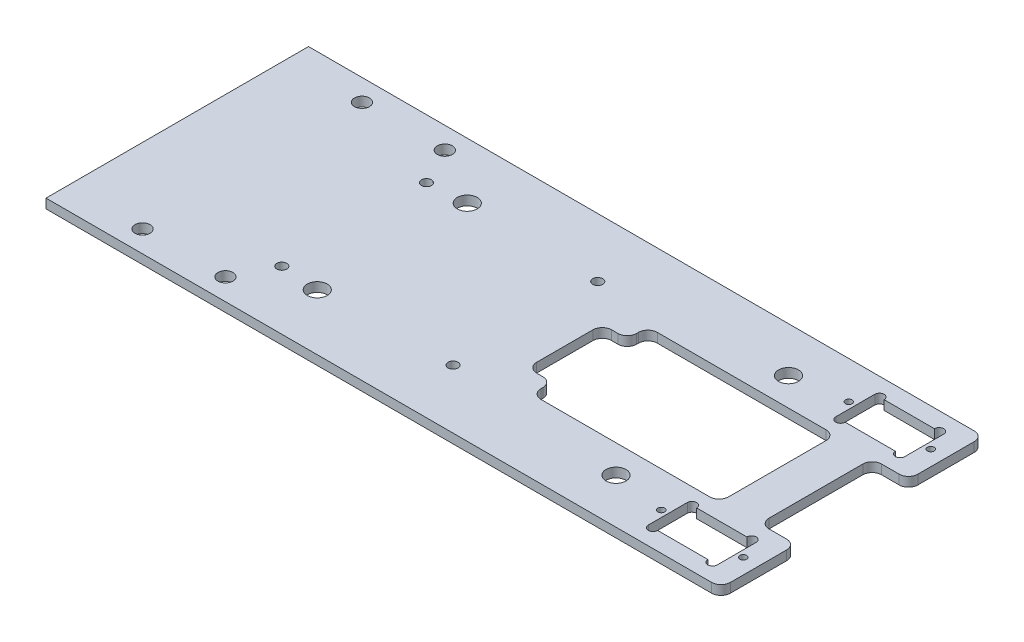
from build123d import *

# Parameters (mm, degrees)
SKETCH1_W           = 304.8
SKETCH1_H           = 101.6
BOSS_EXTRUDE1_DEPTH = 3.175
SKETCH2_R           = 1.6891
CUT_EXTRUDE1_DEPTH  = 161.675077797
SKETCH4_W           = 329.101017338
SKETCH4_H           = 140.380533162
SKETCH4_W_2         = 228.6
SKETCH4_H_2         = 88.9
CUT_EXTRUDE3_DEPTH  = 161.675077797
SKETCH6_R           = 2.5527
SKETCH6_R_2         = 3.3782
CUT_EXTRUDE4_DEPTH  = 123.679962198
CUT_EXTRUDE5_DEPTH  = 123.679962198
SKETCH8_W           = 24.61012588
SKETCH8_H           = 38.1
CUT_EXTRUDE6_DEPTH  = 123.679962198
FILLET1_R           = 3.175
SKETCH9_R           = 1.143
CUT_EXTRUDE7_DEPTH  = 123.679962198


with BuildPart() as part:
    # Sketch1 → Boss-Extrude1 (new body)
    with BuildSketch(Plane(origin=(0, 0, 0), x_dir=(1, 0, 0), z_dir=(0, 1, 0))):
        Rectangle(SKETCH1_W, SKETCH1_H)
    extrude(amount=BOSS_EXTRUDE1_DEPTH)

    # Sketch2 → Cut-Extrude1 (cut, through all)
    with BuildSketch(Plane(origin=(0, 3.175, 0), x_dir=(1, 0, 0), z_dir=(0, 1, 0))):
        with Locations((-54.4, -24.5)):
            Circle(SKETCH2_R)
        with Locations((3.6, -24.5)):
            Circle(SKETCH2_R)
        with Locations((3.6, 24.5)):
            Circle(SKETCH2_R)
        with Locations((-54.4, 24.5)):
            Circle(SKETCH2_R)
    extrude(amount=-CUT_EXTRUDE1_DEPTH, mode=Mode.SUBTRACT)

    # Sketch4 → Cut-Extrude3 (cut, through all)
    with BuildSketch(Plane(origin=(0, 3.175, 0), x_dir=(1, 0, 0), z_dir=(0, 1, 0))):
        Rectangle(SKETCH4_W, SKETCH4_H)
        Rectangle(SKETCH4_W_2, SKETCH4_H_2, mode=Mode.SUBTRACT)
    extrude(amount=-CUT_EXTRUDE3_DEPTH, mode=Mode.SUBTRACT)

    # Sketch6 → Cut-Extrude4 (cut, through all)
    with BuildSketch(Plane(origin=(0, 3.175, 0), x_dir=(1, 0, 0), z_dir=(0, 1, 0))):
        with Locations((-88.9, -37.1475)):
            Circle(SKETCH6_R)
        with Locations((-60.833, -37.1475)):
            Circle(SKETCH6_R)
        with Locations((-41.48582, -25.4)):
            Circle(SKETCH6_R_2)
        with Locations((63.5, -29.21)):
            Circle(SKETCH6_R_2)
        with Locations((63.5, 29.21)):
            Circle(SKETCH6_R_2)
        with Locations((-41.48582, 25.4)):
            Circle(SKETCH6_R_2)
        with Locations((-60.833, 37.1475)):
            Circle(SKETCH6_R)
        with Locations((-88.9, 37.1475)):
            Circle(SKETCH6_R)
    extrude(amount=-CUT_EXTRUDE4_DEPTH, mode=Mode.SUBTRACT)

    # Sketch7 → Cut-Extrude5 (cut, through all)
    with BuildSketch(Plane(origin=(0, 3.175, 0), x_dir=(1, 0, 0), z_dir=(0, 1, 0))):
        Polygon((16.93333418, 12.7), (16.93333418, -12.7), (25.400000847, -12.7), (25.400000847, -19.685), (88.900000847, -19.685), (88.900000847, 19.685), (25.400000847, 19.685), (25.400000847, 12.7), align=None)
    extrude(amount=-CUT_EXTRUDE5_DEPTH, mode=Mode.SUBTRACT)

    # Sketch8 → Cut-Extrude6 (cut, through all)
    with BuildSketch(Plane(origin=(0, 3.175, 0), x_dir=(1, 0, 0), z_dir=(0, 1, 0))):
        with Locations((114.3, 0)):
            Rectangle(SKETCH8_W, SKETCH8_H)
    extrude(amount=-CUT_EXTRUDE6_DEPTH, mode=Mode.SUBTRACT)

    # Fillet1
    fillet1_edges = [part.edges().sort_by_distance(p)[0] for p in [
        (16.93333418, 1.5875, -12.7),
        (25.400000847, 1.5875, -19.685),
        (25.400000847, 1.5875, -12.7),
        (16.93333418, 1.5875, 12.7),
        (25.400000847, 1.5875, 12.7),
        (25.400000847, 1.5875, 19.685),
        (88.900000847, 1.5875, 19.685),
        (88.900000847, 1.5875, -19.685),
        (101.99493706, 1.5875, 19.05),
        (101.99493706, 1.5875, -19.05),
        (114.3, 1.5875, 19.05),
        (114.3, 1.5875, -19.05),
        (114.3, 1.5875, 44.45),
        (114.3, 1.5875, -44.45),
    ]]
    fillet(fillet1_edges, radius=FILLET1_R)

    # Sketch9 → Cut-Extrude7 (cut, through all)
    with BuildSketch(Plane(origin=(0, 3.175, 0), x_dir=(1, 0, 0), z_dir=(0, 1, 0))):
        with Locations((109.135746644, -31.746975739)):
            Circle(SKETCH9_R)
        with Locations((81.364253035, -31.750477776)):
            Circle(SKETCH9_R)
        with Locations((109.135746644, 31.746975739)):
            Circle(SKETCH9_R)
        with Locations((81.364253035, 31.750477776)):
            Circle(SKETCH9_R)
        with BuildLine():
            Line((106.933167153, -38.351453802), (106.933167153, -25.143453797))
            ThreePointArc((106.933167153, -25.143453797), (105.345566976, -23.555953794), (103.758166995, -25.143653809))
            Line((103.758166995, -25.143653809), (86.74016713, -25.145799811))
            ThreePointArc((86.74016713, -25.145799811), (85.15256705, -23.5585), (83.565167142, -25.145999997))
            Line((83.565167142, -25.145999997), (83.565167142, -38.354000003))
            ThreePointArc((83.565167142, -38.354000003), (85.152767186, -39.9415), (86.74016713, -38.353799916))
            Line((86.74016713, -38.353799916), (103.758166995, -38.351653914))
            ThreePointArc((103.758166995, -38.351653914), (105.345767039, -39.938954134), (106.933167153, -38.351453802))
        make_face()
        with BuildLine():
            Line((86.74016713, 25.145799811), (103.758166995, 25.143653809))
            ThreePointArc((103.758166995, 25.143653809), (105.345566976, 23.555953794), (106.933167153, 25.143453797))
            Line((106.933167153, 25.143453797), (106.933167153, 38.351453802))
            ThreePointArc((106.933167153, 38.351453802), (105.345767039, 39.938954134), (103.758166995, 38.351653914))
            Line((103.758166995, 38.351653914), (86.74016713, 38.353799916))
            ThreePointArc((86.74016713, 38.353799916), (85.152767186, 39.9415), (83.565167142, 38.354000003))
            Line((83.565167142, 38.354000003), (83.565167142, 25.145999997))
            ThreePointArc((83.565167142, 25.145999997), (85.15256705, 23.5585), (86.74016713, 25.145799811))
        make_face()
    extrude(amount=-CUT_EXTRUDE7_DEPTH, mode=Mode.SUBTRACT)


solid = part.part
